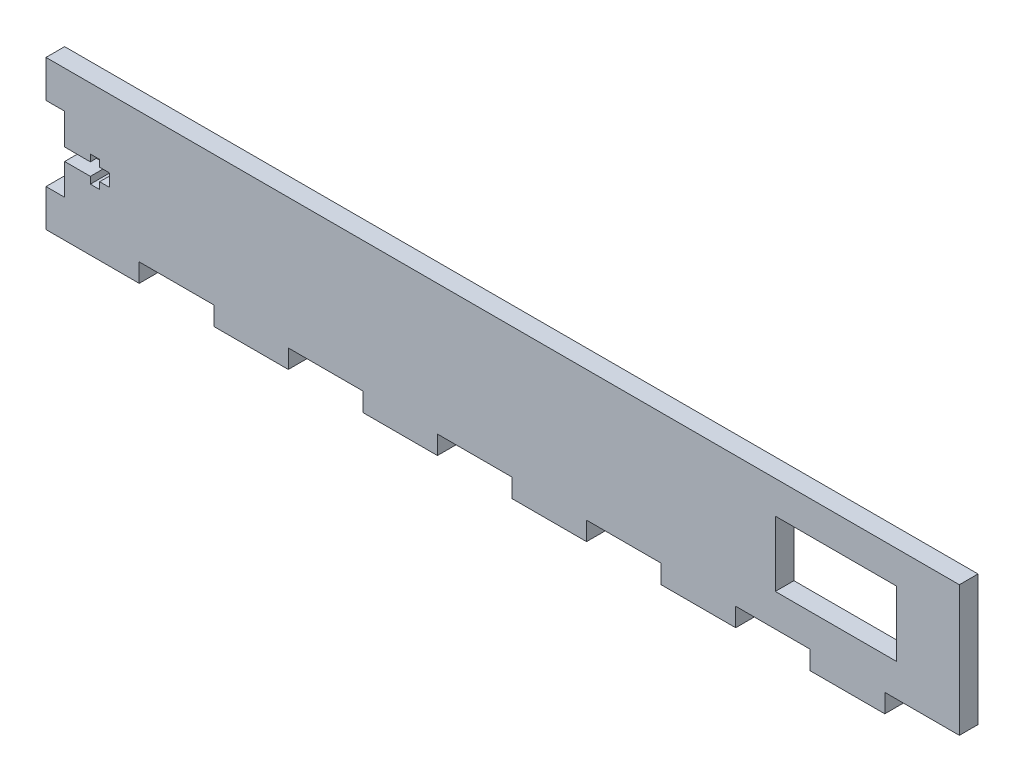
from build123d import *

# Parameters (mm, degrees)
SKETCH1_W           = 304.8
SKETCH1_H           = 44.45
BOSS_EXTRUDE1_DEPTH = 6.35
SKETCH2_W           = 41.275
SKETCH2_H           = 22.225
CUT_EXTRUDE1_DEPTH  = 264.747800776
SKETCH5_W           = 25.4
SKETCH5_H           = 6.35
BOSS_EXTRUDE2_DEPTH = 6.35
LPATTERN1_COUNT     = 6
LPATTERN1_PITCH     = 50.8
SKETCH6_W           = 6.35
SKETCH6_H           = 12.7
BOSS_EXTRUDE3_DEPTH = 6.35
LPATTERN2_COUNT     = 2
LPATTERN2_PITCH     = 38.1
CUT_EXTRUDE2_DEPTH  = 271.670489736


with BuildPart() as part:
    # Sketch1 → Boss-Extrude1 (new body)
    with BuildSketch(Plane.XY):
        with Locations((-110.333, 0)):
            Rectangle(SKETCH1_W, SKETCH1_H)
    extrude(amount=BOSS_EXTRUDE1_DEPTH)

    # Sketch2 → Cut-Extrude1 (cut, through all)
    with BuildSketch(Plane.XY.offset(6.35)):
        Rectangle(SKETCH2_W, SKETCH2_H)
    extrude(amount=-CUT_EXTRUDE1_DEPTH, mode=Mode.SUBTRACT)

    # Sketch5 → Boss-Extrude2 (add)
    with BuildSketch(Plane.XZ.offset(22.225)):
        with Locations((3.967, 3.175)):
            Rectangle(SKETCH5_W, SKETCH5_H)
    boss_extrude2 = extrude(amount=BOSS_EXTRUDE2_DEPTH)

    # LPattern1: Boss-Extrude2 ×6
    with Locations(*[(-i * LPATTERN1_PITCH, 0, 0) for i in range(1, LPATTERN1_COUNT)]):
        add(boss_extrude2)

    # Sketch6 → Boss-Extrude3 (add)
    with BuildSketch(Plane.ZY.offset(262.733)):
        with Locations((3.175, 15.875)):
            Rectangle(SKETCH6_W, SKETCH6_H)
    boss_extrude3 = extrude(amount=BOSS_EXTRUDE3_DEPTH)

    # LPattern2: Boss-Extrude3 ×2
    with Locations(*[(0, -i * LPATTERN2_PITCH, 0) for i in range(1, LPATTERN2_COUNT)]):
        add(boss_extrude3)

    # Sketch7 → Cut-Extrude2 (cut, through all)
    with BuildSketch(Plane.XY.offset(6.35)):
        Polygon((-262.733, -1.0414), (-262.733, -5.3086), (-253.97, -5.3086), (-253.97, -7.62), (-250.795, -7.62), (-250.795, -5.3086), (-247.493, -5.3086), (-247.493, -1.0414), (-250.795, -1.0414), (-250.795, 1.27), (-253.97, 1.27), (-253.97, -1.0414), align=None)
    extrude(amount=-CUT_EXTRUDE2_DEPTH, mode=Mode.SUBTRACT)


solid = part.part
